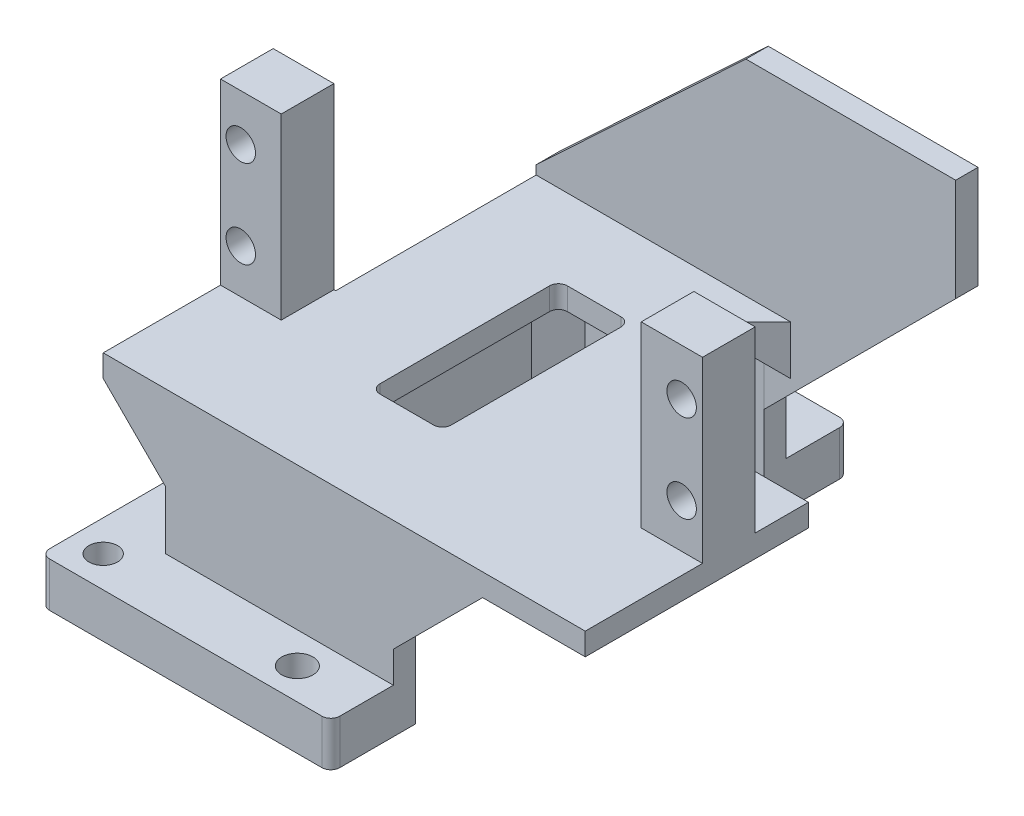
from build123d import *

# Parameters (mm, degrees)
BOSS_EXTRUDE1_DEPTH = 3.5
BOSS_EXTRUDE2_DEPTH = 21
SKETCH3_W           = 23
SKETCH3_H           = 39
BOSS_EXTRUDE3_DEPTH = 2.5
SKETCH5_W           = 21.5
SKETCH5_H           = 25
SKETCH5_W_2         = 7.07
SKETCH5_H_2         = 19.04
BOSS_EXTRUDE5_DEPTH = 2.5
SKETCH6_W           = 7.07
SKETCH6_H           = 5.9
BOSS_EXTRUDE6_DEPTH = 20
BOSS_EXTRUDE7_DEPTH = 23
FILLET1_SIZE        = 10
SKETCH9_R           = 2.475
BOSS_EXTRUDE8_DEPTH = 9
FILLET2_R           = 0.5
SKETCH10_R          = 1.65
CUT_EXTRUDE1_DEPTH  = 9
SKETCH11_W          = 0.2
SKETCH11_H          = 20
CUT_EXTRUDE2_DEPTH  = 9
CUT_EXTRUDE3_DEPTH  = 9
FILLET3_SIZE        = 3
BOSS_EXTRUDE9_DEPTH = 5
SKETCH14_R          = 1.747814763
SKETCH14_R_2        = 1.6
CUT_EXTRUDE4_DEPTH  = 15
SKETCH15_W          = 110
SKETCH15_H          = 3.5
CUT_EXTRUDE5_DEPTH  = 150
FILLET4_SIZE        = 7
FILLET5_SIZE        = 3
FILLET6_SIZE        = 3
SKETCH17_W          = 8
SKETCH17_H          = 21
CUT_EXTRUDE6_DEPTH  = 150
FILLET7_R           = 1
FILLET8_R           = 1
FILLET9_SIZE        = 3


# Some blends are built 0.0001 mm under size
with BuildPart() as part:
    # Sketch1 → Boss-Extrude1 (new body)
    with BuildSketch(Plane(origin=(0, 0, 0), x_dir=(1, 0, 0), z_dir=(0, 1, 0))):
        Polygon((0, 40), (23, 40), (23, 79), (0, 79), (0, 100), (110, 100), (110, 79), (87, 79), (87, 40), (110, 40), (110, 20), (80, 0), (30, 0), (0, 20), align=None)
    extrude(amount=BOSS_EXTRUDE1_DEPTH)

    # Sketch2 → Boss-Extrude2 (add)
    with BuildSketch(Plane(origin=(0, 3.5, 0), x_dir=(1, 0, 0), z_dir=(0, 1, 0))):
        Polygon((0, 79), (23, 79), (23, 40), (0, 40), (0, 37.5), (25.5, 37.5), (25.5, 81.5), (0, 81.5), align=None)
        Polygon((110, 81.5), (84.5, 81.5), (84.5, 37.5), (110, 37.5), (110, 40), (87, 40), (87, 79), (110, 79), align=None)
    extrude(amount=BOSS_EXTRUDE2_DEPTH)

    # Sketch3 → Boss-Extrude3 (add)
    with BuildSketch(Plane(origin=(0, 24.5, 0), x_dir=(1, 0, 0), z_dir=(0, 1, 0))):
        with Locations((11.5, 59.5)):
            Rectangle(SKETCH3_W, SKETCH3_H)
        with Locations((98.5, 59.5)):
            Rectangle(SKETCH3_W, SKETCH3_H)
    extrude(amount=-BOSS_EXTRUDE3_DEPTH)

    # Sketch5 → Boss-Extrude5 (add)
    with BuildSketch(Plane(origin=(0, 24.5, 0), x_dir=(1, 0, 0), z_dir=(0, 1, 0))):
        with Locations((120.75, 50)):
            Rectangle(SKETCH5_W, SKETCH5_H)
        with Locations((-10.75, 50)):
            Rectangle(SKETCH5_W, SKETCH5_H)
        with Locations((29.035, 47.02)):
            Rectangle(SKETCH5_W_2, SKETCH5_H_2)
        with Locations((80.965, 47.02)):
            Rectangle(SKETCH5_W_2, SKETCH5_H_2)
    extrude(amount=-BOSS_EXTRUDE5_DEPTH)

    # Sketch6 → Boss-Extrude6 (add)
    with BuildSketch(Plane(origin=(0, 24.5, 0), x_dir=(1, 0, 0), z_dir=(0, 1, 0))):
        with Locations((29.035, 53.59)):
            Rectangle(SKETCH6_W, SKETCH6_H)
        with Locations((80.965, 53.59)):
            Rectangle(SKETCH6_W, SKETCH6_H)
        with Locations((-17.965, 53.59)):
            Rectangle(SKETCH6_W, SKETCH6_H)
        with Locations((127.965, 53.59)):
            Rectangle(SKETCH6_W, SKETCH6_H)
    extrude(amount=BOSS_EXTRUDE6_DEPTH)

    # Sketch7 → Boss-Extrude7 (add)
    with BuildSketch(Plane(origin=(0, 24.5, 0), x_dir=(1, 0, 0), z_dir=(0, 1, 0))):
        Polygon((0, 81.5), (25.5, 81.5), (25.5, 79), (0, 79), (-21.5, 79), (-21.5, 81.5), align=None)
        Polygon((110, 79), (84.5, 79), (84.5, 81.5), (110, 81.5), (131.5, 81.5), (131.5, 79), align=None)
    extrude(amount=BOSS_EXTRUDE7_DEPTH)

    # Fillet1
    # the kernel refuses this chamfer: 10 mm, written as the material it adds along each edge
    with BuildSketch(Plane(origin=(0, 22, -40), x_dir=(0.027495876610586372, -0.9996219169112968, 0), z_dir=(0, 0, 1)), Plane(origin=(110, 22, -37.5), x_dir=(-0.027495876610586317, -0.9996219169112968, 0), z_dir=(0, 0, -1)), Plane(origin=(110, 24.5, -81.5), x_dir=(0.9996219169112968, 0.027495876610586317, 0), z_dir=(0, 0, 1))) as fillet1_piece_1:
        Polygon((FILLET1_SIZE * 0.999621916911, -FILLET1_SIZE * 0.0274958766106), (-FILLET1_SIZE * 0.0274958766106, -FILLET1_SIZE * 0.999621916911), (0, 0), align=None)
    extrude(amount=2.5)
    with BuildSketch(Plane(origin=(0, 24.5, -79), x_dir=(0.027495876610586372, -0.9996219169112968, 0), z_dir=(0, 0, -1))) as fillet1_piece_2:
        Polygon((FILLET1_SIZE * 0.999621916911, FILLET1_SIZE * 0.0274958766106), (-FILLET1_SIZE * 0.0274958766106, FILLET1_SIZE * 0.999621916911), (0, 0), align=None)
    extrude(amount=2.5)

    # Sketch9 → Boss-Extrude8 (add)
    with BuildSketch(Plane(origin=(0, 0, -81.5), x_dir=(-1, 0, 0), z_dir=(0, 0, -1))):
        with Locations(Location((-114.55, 34.35, 0), (0, 0, 180))):
            Circle(SKETCH9_R)
        with Locations(Location((4.55, 34.35, 0), (0, 0, 180))):
            Circle(SKETCH9_R)
    extrude(amount=BOSS_EXTRUDE8_DEPTH)

    # Fillet2
    fillet2_edges = [part.edges().sort_by_distance(p)[0] for p in [
        (112.075, 34.35, -90.5),
        (-7.025, 34.35, -90.5),
    ]]
    fillet(fillet2_edges, radius=FILLET2_R)

    # Sketch10 → Cut-Extrude1 (cut)
    with BuildSketch(Plane.XY.offset(-50.64)):
        with Locations((129.16, 39.27)):
            Circle(SKETCH10_R)
        with Locations((129.16, 29.43)):
            Circle(SKETCH10_R)
        with Locations((79.77, 39.27)):
            Circle(SKETCH10_R)
        with Locations((79.77, 29.43)):
            Circle(SKETCH10_R)
        with Locations((-19.16, 29.43)):
            Circle(SKETCH10_R)
        with Locations((-19.16, 39.27)):
            Circle(SKETCH10_R)
        with Locations(Location((30.23, 39.27, 0), (0, 0, 180))):
            Circle(SKETCH10_R)
        with Locations(Location((30.23, 29.43, 0), (0, 0, 180))):
            Circle(SKETCH10_R)
    extrude(amount=-CUT_EXTRUDE1_DEPTH, mode=Mode.SUBTRACT)

    # Sketch11 → Cut-Extrude2 (cut)
    with BuildSketch(Plane.XY.offset(-50.64)):
        with Locations((-14.53, 34.5)):
            Rectangle(SKETCH11_W, SKETCH11_H)
        with Locations((25.6, 34.5)):
            Rectangle(SKETCH11_W, SKETCH11_H)
        with Locations((84.4, 34.5)):
            Rectangle(SKETCH11_W, SKETCH11_H)
        with Locations((124.53, 34.5)):
            Rectangle(SKETCH11_W, SKETCH11_H)
    extrude(amount=-CUT_EXTRUDE2_DEPTH, mode=Mode.SUBTRACT)

    # Sketch12 → Cut-Extrude3 (cut)
    with BuildSketch(Plane(origin=(0, 0, -81.5), x_dir=(-1, 0, 0), z_dir=(0, 0, -1))):
        Polygon((-108, 47.5), (-84.5, 25.5), (-84.5, 47.5), align=None)
        Polygon((-25.5, 25.5), (-25.5, 47.5), (-2, 47.5), align=None)
        Polygon((-120, 24.5), (-131.5, 36), (-131.5, 24.5), align=None)
        Polygon((10, 24.5), (21.5, 36), (21.5, 24.5), align=None)
    extrude(amount=-CUT_EXTRUDE3_DEPTH, mode=Mode.SUBTRACT)

    # Fillet3
    fillet3_edges = [part.edges().sort_by_distance(p)[0] for p in [
        (0, 23.25, -62.5),
        (110, 23.25, -62.5),
    ]]
    chamfer(fillet3_edges, length=FILLET3_SIZE)

    # Sketch13 → Boss-Extrude9 (add)
    with BuildSketch(Plane(origin=(0, 3.5, 0), x_dir=(1, 0, 0), z_dir=(0, 1, 0))):
        Polygon((0, 30.5), (32.5, 30.5), (32.5, 88.5), (0, 88.5), (0, 81.5), (25.5, 81.5), (25.5, 37.5), (0, 37.5), align=None)
        Polygon((84.5, 37.5), (110, 37.5), (110, 30.5), (77.5, 30.5), (77.5, 88.5), (110, 88.5), (110, 81.5), (84.5, 81.5), align=None)
    extrude(amount=BOSS_EXTRUDE9_DEPTH)

    # Sketch14 → Cut-Extrude4 (cut)
    with BuildSketch(Plane(origin=(0, 8.5, 0), x_dir=(1, 0, 0), z_dir=(0, 1, 0))):
        with Locations(Location((7.25, 34, 0), (0, 0, 270))):
            Circle(SKETCH14_R)
        with Locations(Location((7.25, 85, 0), (0, 0, 270))):
            Circle(SKETCH14_R_2)
        with Locations(Location((29, 34, 0), (0, 0, 270))):
            Circle(SKETCH14_R_2)
        with Locations(Location((29, 59.5, 0), (0, 0, 270))):
            Circle(SKETCH14_R_2)
        with Locations(Location((29, 85, 0), (0, 0, 270))):
            Circle(SKETCH14_R_2)
        with Locations(Location((81, 34, 0), (0, 0, 90))):
            Circle(SKETCH14_R_2)
        with Locations(Location((102.75, 34, 0), (0, 0, 90))):
            Circle(SKETCH14_R)
        with Locations(Location((81, 59.5, 0), (0, 0, 90))):
            Circle(SKETCH14_R_2)
        with Locations(Location((81, 85, 0), (0, 0, 90))):
            Circle(SKETCH14_R_2)
        with Locations(Location((102.75, 85, 0), (0, 0, 90))):
            Circle(SKETCH14_R_2)
    extrude(amount=-CUT_EXTRUDE4_DEPTH, mode=Mode.SUBTRACT)

    # Sketch15 → Cut-Extrude5 (cut)
    with BuildSketch(Plane(origin=(0, 0, -100), x_dir=(-1, 0, 0), z_dir=(0, 0, -1))):
        Polygon((-77.5, 47.5), (-77.5, 3.5), (0, 3.5), (21.5, 3.5), (21.5, 47.5), align=None)
        with Locations((-55, 1.75)):
            Rectangle(SKETCH15_W, SKETCH15_H)
    extrude(amount=-CUT_EXTRUDE5_DEPTH, mode=Mode.SUBTRACT)

    # Fillet4
    fillet4_edges = [part.edges().sort_by_distance(p)[0] for p in [
        (84.5, 22, -47.02),
    ]]
    chamfer(fillet4_edges, length=FILLET4_SIZE - 0.0001)  # a hair under: the kernel refuses the full size

    # Fillet5
    fillet5_edges = [part.edges().sort_by_distance(p)[0] for p in [
        (87, 22, -59.5),
        (98.5, 22, -79),
        (103.5, 22, -40),
    ]]
    chamfer(fillet5_edges, length=FILLET5_SIZE)

    # Fillet6
    fillet6_edges = [part.edges().sort_by_distance(p)[0] for p in [
        (110, 21.75, -79),
    ]]
    chamfer(fillet6_edges, length=FILLET6_SIZE)

    # Sketch17 → Cut-Extrude6 (cut)
    with BuildSketch(Plane.XZ.offset(-22)):
        with Locations((100, -59.5)):
            Rectangle(SKETCH17_W, SKETCH17_H)
    extrude(amount=-CUT_EXTRUDE6_DEPTH, mode=Mode.SUBTRACT)

    # Fillet7
    fillet7_edges = [part.edges().sort_by_distance(p)[0] for p in [
        (96, 23.25, -70),
        (96, 23.25, -49),
        (104, 23.25, -49),
        (104, 23.25, -70),
    ]]
    fillet(fillet7_edges, radius=FILLET7_R)

    # Fillet8
    fillet8_edges = [part.edges().sort_by_distance(p)[0] for p in [
        (110, 6, -88.5),
        (77.5, 6, -88.5),
        (77.5, 6, -30.5),
        (110, 6, -30.5),
    ]]
    fillet(fillet8_edges, radius=FILLET8_R)

    # Fillet9
    fillet9_edges = [part.edges().sort_by_distance(p)[0] for p in [
        (87, 11.25, -79),
        (87, 11.25, -40),
    ]]
    chamfer(fillet9_edges, length=FILLET9_SIZE)


solid = part.part
